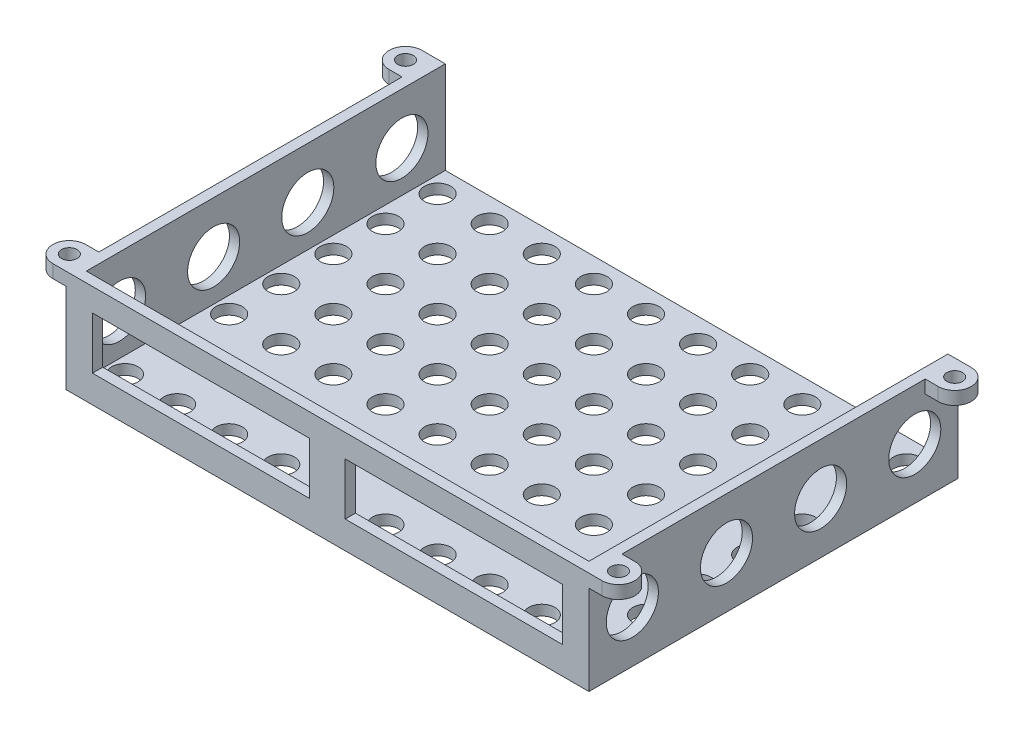
from build123d import *

# Parameters (mm, degrees)
SKETCH1_W                  = 153
SKETCH1_H                  = 108
BOSS_EXTRUDE1_DEPTH        = 30
SHELL1_T                   = -3
SKETCH7_R                  = 2.286
BOSS_EXTRUDE7_DEPTH        = 3.81
SKETCH24_R                 = 3.845268573
CUT_EXTRUDE8_DEPTH         = 25.4
LPATTERN5_COUNT            = 10
LPATTERN5_PITCH            = 15.24
LPATTERN6_COPY_1_SKETCH_R  = 3.845268573
LPATTERN6_COPY_1_DEPTH     = 25.4
LPATTERN6_COPY_2_SKETCH_R  = 3.845268573
LPATTERN6_COPY_2_DEPTH     = 25.4
LPATTERN6_COPY_3_SKETCH_R  = 3.845268573
LPATTERN6_COPY_3_DEPTH     = 25.4
LPATTERN6_COPY_4_SKETCH_R  = 3.845268573
LPATTERN6_COPY_4_DEPTH     = 25.4
LPATTERN6_COPY_5_SKETCH_R  = 3.845268573
LPATTERN6_COPY_5_DEPTH     = 25.4
LPATTERN6_COPY_6_SKETCH_R  = 3.845268573
LPATTERN6_COPY_6_DEPTH     = 25.4
LPATTERN6_COPY_7_SKETCH_R  = 3.845268573
LPATTERN6_COPY_7_DEPTH     = 25.4
LPATTERN6_COPY_8_SKETCH_R  = 3.845268573
LPATTERN6_COPY_8_DEPTH     = 25.4
LPATTERN6_COPY_9_SKETCH_R  = 3.845268573
LPATTERN6_COPY_9_DEPTH     = 25.4
LPATTERN6_COPY_10_SKETCH_R = 3.845268573
LPATTERN6_COPY_10_DEPTH    = 25.4
LPATTERN6_COPY_11_SKETCH_R = 3.845268573
LPATTERN6_COPY_11_DEPTH    = 25.4
LPATTERN6_COPY_12_SKETCH_R = 3.845268573
LPATTERN6_COPY_12_DEPTH    = 25.4
LPATTERN6_COPY_13_SKETCH_R = 3.845268573
LPATTERN6_COPY_13_DEPTH    = 25.4
LPATTERN6_COPY_14_SKETCH_R = 3.845268573
LPATTERN6_COPY_14_DEPTH    = 25.4
LPATTERN6_COPY_15_SKETCH_R = 3.845268573
LPATTERN6_COPY_15_DEPTH    = 25.4
LPATTERN6_COPY_16_SKETCH_R = 3.845268573
LPATTERN6_COPY_16_DEPTH    = 25.4
LPATTERN6_COPY_17_SKETCH_R = 3.845268573
LPATTERN6_COPY_17_DEPTH    = 25.4
LPATTERN6_COPY_18_SKETCH_R = 3.845268573
LPATTERN6_COPY_18_DEPTH    = 25.4
LPATTERN6_COPY_19_SKETCH_R = 3.845268573
LPATTERN6_COPY_19_DEPTH    = 25.4
LPATTERN6_COPY_20_SKETCH_R = 3.845268573
LPATTERN6_COPY_20_DEPTH    = 25.4
LPATTERN6_COPY_21_SKETCH_R = 3.845268573
LPATTERN6_COPY_21_DEPTH    = 25.4
LPATTERN6_COPY_22_SKETCH_R = 3.845268573
LPATTERN6_COPY_22_DEPTH    = 25.4
LPATTERN6_COPY_23_SKETCH_R = 3.845268573
LPATTERN6_COPY_23_DEPTH    = 25.4
LPATTERN6_COPY_24_SKETCH_R = 3.845268573
LPATTERN6_COPY_24_DEPTH    = 25.4
LPATTERN6_COPY_25_SKETCH_R = 3.845268573
LPATTERN6_COPY_25_DEPTH    = 25.4
LPATTERN6_COPY_26_SKETCH_R = 3.845268573
LPATTERN6_COPY_26_DEPTH    = 25.4
LPATTERN6_COPY_27_SKETCH_R = 3.845268573
LPATTERN6_COPY_27_DEPTH    = 25.4
LPATTERN6_COPY_28_SKETCH_R = 3.845268573
LPATTERN6_COPY_28_DEPTH    = 25.4
LPATTERN6_COPY_29_SKETCH_R = 3.845268573
LPATTERN6_COPY_29_DEPTH    = 25.4
LPATTERN6_COPY_30_SKETCH_R = 3.845268573
LPATTERN6_COPY_30_DEPTH    = 25.4
LPATTERN6_COPY_31_SKETCH_R = 3.845268573
LPATTERN6_COPY_31_DEPTH    = 25.4
LPATTERN6_COPY_32_SKETCH_R = 3.845268573
LPATTERN6_COPY_32_DEPTH    = 25.4
LPATTERN6_COPY_33_SKETCH_R = 3.845268573
LPATTERN6_COPY_33_DEPTH    = 25.4
LPATTERN6_COPY_34_SKETCH_R = 3.845268573
LPATTERN6_COPY_34_DEPTH    = 25.4
LPATTERN6_COPY_35_SKETCH_R = 3.845268573
LPATTERN6_COPY_35_DEPTH    = 25.4
LPATTERN6_COPY_36_SKETCH_R = 3.845268573
LPATTERN6_COPY_36_DEPTH    = 25.4
LPATTERN6_COPY_37_SKETCH_R = 3.845268573
LPATTERN6_COPY_37_DEPTH    = 25.4
LPATTERN6_COPY_38_SKETCH_R = 3.845268573
LPATTERN6_COPY_38_DEPTH    = 25.4
LPATTERN6_COPY_39_SKETCH_R = 3.845268573
LPATTERN6_COPY_39_DEPTH    = 25.4
LPATTERN6_COPY_40_SKETCH_R = 3.845268573
LPATTERN6_COPY_40_DEPTH    = 25.4
LPATTERN6_COPY_41_SKETCH_R = 3.845268573
LPATTERN6_COPY_41_DEPTH    = 25.4
LPATTERN6_COPY_42_SKETCH_R = 3.845268573
LPATTERN6_COPY_42_DEPTH    = 25.4
LPATTERN6_COPY_43_SKETCH_R = 3.845268573
LPATTERN6_COPY_43_DEPTH    = 25.4
LPATTERN6_COPY_44_SKETCH_R = 3.845268573
LPATTERN6_COPY_44_DEPTH    = 25.4
LPATTERN6_COPY_45_SKETCH_R = 3.845268573
LPATTERN6_COPY_45_DEPTH    = 25.4
LPATTERN6_COPY_46_SKETCH_R = 3.845268573
LPATTERN6_COPY_46_DEPTH    = 25.4
LPATTERN6_COPY_47_SKETCH_R = 3.845268573
LPATTERN6_COPY_47_DEPTH    = 25.4
LPATTERN6_COPY_48_SKETCH_R = 3.845268573
LPATTERN6_COPY_48_DEPTH    = 25.4
LPATTERN6_COPY_49_SKETCH_R = 3.845268573
LPATTERN6_COPY_49_DEPTH    = 25.4
LPATTERN6_COPY_50_SKETCH_R = 3.845268573
LPATTERN6_COPY_50_DEPTH    = 25.4
LPATTERN6_COPY_51_SKETCH_R = 3.845268573
LPATTERN6_COPY_51_DEPTH    = 25.4
LPATTERN6_COPY_52_SKETCH_R = 3.845268573
LPATTERN6_COPY_52_DEPTH    = 25.4
LPATTERN6_COPY_53_SKETCH_R = 3.845268573
LPATTERN6_COPY_53_DEPTH    = 25.4
LPATTERN6_COPY_54_SKETCH_R = 3.845268573
LPATTERN6_COPY_54_DEPTH    = 25.4
LPATTERN6_COPY_55_SKETCH_R = 3.845268573
LPATTERN6_COPY_55_DEPTH    = 25.4
LPATTERN6_COPY_56_SKETCH_R = 3.845268573
LPATTERN6_COPY_56_DEPTH    = 25.4
LPATTERN6_COPY_57_SKETCH_R = 3.845268573
LPATTERN6_COPY_57_DEPTH    = 25.4
LPATTERN6_COPY_58_SKETCH_R = 3.845268573
LPATTERN6_COPY_58_DEPTH    = 25.4
LPATTERN6_COPY_59_SKETCH_R = 3.845268573
LPATTERN6_COPY_59_DEPTH    = 25.4
LPATTERN6_COPY_60_SKETCH_R = 3.845268573
LPATTERN6_COPY_60_DEPTH    = 25.4
LPATTERN6_COPY_61_SKETCH_R = 3.845268573
LPATTERN6_COPY_61_DEPTH    = 25.4
LPATTERN6_COPY_62_SKETCH_R = 3.845268573
LPATTERN6_COPY_62_DEPTH    = 25.4
LPATTERN6_COPY_63_SKETCH_R = 3.845268573
LPATTERN6_COPY_63_DEPTH    = 25.4
LPATTERN6_COPY_64_SKETCH_R = 3.845268573
LPATTERN6_COPY_64_DEPTH    = 25.4
LPATTERN6_COPY_65_SKETCH_R = 3.845268573
LPATTERN6_COPY_65_DEPTH    = 25.4
LPATTERN6_COPY_66_SKETCH_R = 3.845268573
LPATTERN6_COPY_66_DEPTH    = 25.4
LPATTERN6_COPY_67_SKETCH_R = 3.845268573
LPATTERN6_COPY_67_DEPTH    = 25.4
LPATTERN6_COPY_68_SKETCH_R = 3.845268573
LPATTERN6_COPY_68_DEPTH    = 25.4
LPATTERN6_COPY_69_SKETCH_R = 3.845268573
LPATTERN6_COPY_69_DEPTH    = 25.4
LPATTERN6_COPY_70_SKETCH_R = 3.845268573
LPATTERN6_COPY_70_DEPTH    = 25.4
LPATTERN6_COPY_71_SKETCH_R = 3.845268573
LPATTERN6_COPY_71_DEPTH    = 25.4
LPATTERN6_COPY_72_SKETCH_R = 3.845268573
LPATTERN6_COPY_72_DEPTH    = 25.4
LPATTERN6_COPY_73_SKETCH_R = 3.845268573
LPATTERN6_COPY_73_DEPTH    = 25.4
LPATTERN6_COPY_74_SKETCH_R = 3.845268573
LPATTERN6_COPY_74_DEPTH    = 25.4
LPATTERN6_COPY_75_SKETCH_R = 3.845268573
LPATTERN6_COPY_75_DEPTH    = 25.4
LPATTERN6_COPY_76_SKETCH_R = 3.845268573
LPATTERN6_COPY_76_DEPTH    = 25.4
LPATTERN6_COPY_77_SKETCH_R = 3.845268573
LPATTERN6_COPY_77_DEPTH    = 25.4
LPATTERN6_COPY_78_SKETCH_R = 3.845268573
LPATTERN6_COPY_78_DEPTH    = 25.4
LPATTERN6_COPY_79_SKETCH_R = 3.845268573
LPATTERN6_COPY_79_DEPTH    = 25.4
LPATTERN6_COPY_80_SKETCH_R = 3.845268573
LPATTERN6_COPY_80_DEPTH    = 25.4
LPATTERN6_COPY_81_SKETCH_R = 3.845268573
LPATTERN6_COPY_81_DEPTH    = 25.4
LPATTERN6_COPY_82_SKETCH_R = 3.845268573
LPATTERN6_COPY_82_DEPTH    = 25.4
LPATTERN6_COPY_83_SKETCH_R = 3.845268573
LPATTERN6_COPY_83_DEPTH    = 25.4
LPATTERN6_COPY_84_SKETCH_R = 3.845268573
LPATTERN6_COPY_84_DEPTH    = 25.4
LPATTERN6_COPY_85_SKETCH_R = 3.845268573
LPATTERN6_COPY_85_DEPTH    = 25.4
LPATTERN6_COPY_86_SKETCH_R = 3.845268573
LPATTERN6_COPY_86_DEPTH    = 25.4
LPATTERN6_COPY_87_SKETCH_R = 3.845268573
LPATTERN6_COPY_87_DEPTH    = 25.4
LPATTERN6_COPY_88_SKETCH_R = 3.845268573
LPATTERN6_COPY_88_DEPTH    = 25.4
LPATTERN6_COPY_89_SKETCH_R = 3.845268573
LPATTERN6_COPY_89_DEPTH    = 25.4
LPATTERN6_COPY_90_SKETCH_R = 3.845268573
LPATTERN6_COPY_90_DEPTH    = 25.4
SKETCH27_W                 = 147
SKETCH27_H                 = 27
CUT_EXTRUDE10_DEPTH        = 5.08
SKETCH30_R                 = 7.62
CUT_EXTRUDE14_DEPTH        = 7.62
MIRROR2_COPY_1_SKETCH_R    = 2.286
MIRROR2_COPY_1_DEPTH       = 3.81
MIRROR2_COPY_2_SKETCH_R    = 2.286
MIRROR2_COPY_2_DEPTH       = 3.81
SKETCH33_W                 = 63.5
SKETCH33_H                 = 15.24
CUT_EXTRUDE16_DEPTH        = 5.08


with BuildPart() as part:
    # Sketch1 → Boss-Extrude1 (new body)
    with BuildSketch(Plane(origin=(0, 0, 0), x_dir=(1, 0, 0), z_dir=(0, 1, 0))):
        with Locations((-76.5, -54)):
            Rectangle(SKETCH1_W, SKETCH1_H)
    extrude(amount=BOSS_EXTRUDE1_DEPTH)

    # Shell1
    shell1_openings = [part.faces().sort_by_distance(p)[0] for p in [
        (-76.5, 30, 54),
    ]]
    offset(amount=SHELL1_T, openings=shell1_openings, kind=Kind.INTERSECTION)

    # Sketch7 → Boss-Extrude7 (add)
    with BuildSketch(Plane(origin=(0, 30, 0), x_dir=(1, 0, 0), z_dir=(0, 1, 0))):
        with BuildLine():
            Line((-156.81, 0), (-153, 0))
            Line((-153, 0), (-153, -9.652))
            Line((-153, -9.652), (-156.81, -9.652))
            ThreePointArc((-156.81, -9.652), (-161.636, -4.826), (-156.81, 0))
        make_face()
        with Locations((-156.81, -4.826)):
            Circle(SKETCH7_R, mode=Mode.SUBTRACT)
    boss_extrude7 = extrude(amount=-BOSS_EXTRUDE7_DEPTH)

    # Sketch24 → Cut-Extrude8 (cut)
    with BuildSketch(Plane.XZ):
        with Locations((-8.055715174, 7.051094555)):
            Circle(SKETCH24_R)
    cut_extrude8 = extrude(amount=-CUT_EXTRUDE8_DEPTH, mode=Mode.SUBTRACT)

    # LPattern5: Cut-Extrude8 ×10
    with Locations(*[(-i * LPATTERN5_PITCH, 0, 0) for i in range(1, LPATTERN5_COUNT)]):
        add(cut_extrude8, mode=Mode.SUBTRACT)

    # LPattern6 copy 1 sketch → LPattern6 copy 1 (cut)
    with BuildSketch(Plane(origin=(-15.24, 0, 15.24), x_dir=(1, 0, 0), z_dir=(0, -1, 0))):
        with Locations((-8.055715174, 7.051094555)):
            Circle(LPATTERN6_COPY_1_SKETCH_R)
    extrude(amount=-LPATTERN6_COPY_1_DEPTH, mode=Mode.SUBTRACT)

    # LPattern6 copy 2 sketch → LPattern6 copy 2 (cut)
    with BuildSketch(Plane(origin=(-15.24, 0, 30.48), x_dir=(1, 0, 0), z_dir=(0, -1, 0))):
        with Locations((-8.055715174, 7.051094555)):
            Circle(LPATTERN6_COPY_2_SKETCH_R)
    extrude(amount=-LPATTERN6_COPY_2_DEPTH, mode=Mode.SUBTRACT)

    # LPattern6 copy 3 sketch → LPattern6 copy 3 (cut)
    with BuildSketch(Plane(origin=(-15.24, 0, 45.72), x_dir=(1, 0, 0), z_dir=(0, -1, 0))):
        with Locations((-8.055715174, 7.051094555)):
            Circle(LPATTERN6_COPY_3_SKETCH_R)
    extrude(amount=-LPATTERN6_COPY_3_DEPTH, mode=Mode.SUBTRACT)

    # LPattern6 copy 4 sketch → LPattern6 copy 4 (cut)
    with BuildSketch(Plane(origin=(-15.24, 0, 60.96), x_dir=(1, 0, 0), z_dir=(0, -1, 0))):
        with Locations((-8.055715174, 7.051094555)):
            Circle(LPATTERN6_COPY_4_SKETCH_R)
    extrude(amount=-LPATTERN6_COPY_4_DEPTH, mode=Mode.SUBTRACT)

    # LPattern6 copy 5 sketch → LPattern6 copy 5 (cut)
    with BuildSketch(Plane(origin=(-15.24, 0, 76.2), x_dir=(1, 0, 0), z_dir=(0, -1, 0))):
        with Locations((-8.055715174, 7.051094555)):
            Circle(LPATTERN6_COPY_5_SKETCH_R)
    extrude(amount=-LPATTERN6_COPY_5_DEPTH, mode=Mode.SUBTRACT)

    # LPattern6 copy 6 sketch → LPattern6 copy 6 (cut)
    with BuildSketch(Plane(origin=(-15.24, 0, 91.44), x_dir=(1, 0, 0), z_dir=(0, -1, 0))):
        with Locations((-8.055715174, 7.051094555)):
            Circle(LPATTERN6_COPY_6_SKETCH_R)
    extrude(amount=-LPATTERN6_COPY_6_DEPTH, mode=Mode.SUBTRACT)

    # LPattern6 copy 7 sketch → LPattern6 copy 7 (cut)
    with BuildSketch(Plane(origin=(-15.24, 0, 106.68), x_dir=(1, 0, 0), z_dir=(0, -1, 0))):
        with Locations((-8.055715174, 7.051094555)):
            Circle(LPATTERN6_COPY_7_SKETCH_R)
    extrude(amount=-LPATTERN6_COPY_7_DEPTH, mode=Mode.SUBTRACT)

    # LPattern6 copy 8 sketch → LPattern6 copy 8 (cut)
    with BuildSketch(Plane(origin=(-15.24, 0, 121.92), x_dir=(1, 0, 0), z_dir=(0, -1, 0))):
        with Locations((-8.055715174, 7.051094555)):
            Circle(LPATTERN6_COPY_8_SKETCH_R)
    extrude(amount=-LPATTERN6_COPY_8_DEPTH, mode=Mode.SUBTRACT)

    # LPattern6 copy 9 sketch → LPattern6 copy 9 (cut)
    with BuildSketch(Plane(origin=(-15.24, 0, 137.16), x_dir=(1, 0, 0), z_dir=(0, -1, 0))):
        with Locations((-8.055715174, 7.051094555)):
            Circle(LPATTERN6_COPY_9_SKETCH_R)
    extrude(amount=-LPATTERN6_COPY_9_DEPTH, mode=Mode.SUBTRACT)

    # LPattern6 copy 10 sketch → LPattern6 copy 10 (cut)
    with BuildSketch(Plane(origin=(-30.48, 0, 15.24), x_dir=(1, 0, 0), z_dir=(0, -1, 0))):
        with Locations((-8.055715174, 7.051094555)):
            Circle(LPATTERN6_COPY_10_SKETCH_R)
    extrude(amount=-LPATTERN6_COPY_10_DEPTH, mode=Mode.SUBTRACT)

    # LPattern6 copy 11 sketch → LPattern6 copy 11 (cut)
    with BuildSketch(Plane(origin=(-30.48, 0, 30.48), x_dir=(1, 0, 0), z_dir=(0, -1, 0))):
        with Locations((-8.055715174, 7.051094555)):
            Circle(LPATTERN6_COPY_11_SKETCH_R)
    extrude(amount=-LPATTERN6_COPY_11_DEPTH, mode=Mode.SUBTRACT)

    # LPattern6 copy 12 sketch → LPattern6 copy 12 (cut)
    with BuildSketch(Plane(origin=(-30.48, 0, 45.72), x_dir=(1, 0, 0), z_dir=(0, -1, 0))):
        with Locations((-8.055715174, 7.051094555)):
            Circle(LPATTERN6_COPY_12_SKETCH_R)
    extrude(amount=-LPATTERN6_COPY_12_DEPTH, mode=Mode.SUBTRACT)

    # LPattern6 copy 13 sketch → LPattern6 copy 13 (cut)
    with BuildSketch(Plane(origin=(-30.48, 0, 60.96), x_dir=(1, 0, 0), z_dir=(0, -1, 0))):
        with Locations((-8.055715174, 7.051094555)):
            Circle(LPATTERN6_COPY_13_SKETCH_R)
    extrude(amount=-LPATTERN6_COPY_13_DEPTH, mode=Mode.SUBTRACT)

    # LPattern6 copy 14 sketch → LPattern6 copy 14 (cut)
    with BuildSketch(Plane(origin=(-30.48, 0, 76.2), x_dir=(1, 0, 0), z_dir=(0, -1, 0))):
        with Locations((-8.055715174, 7.051094555)):
            Circle(LPATTERN6_COPY_14_SKETCH_R)
    extrude(amount=-LPATTERN6_COPY_14_DEPTH, mode=Mode.SUBTRACT)

    # LPattern6 copy 15 sketch → LPattern6 copy 15 (cut)
    with BuildSketch(Plane(origin=(-30.48, 0, 91.44), x_dir=(1, 0, 0), z_dir=(0, -1, 0))):
        with Locations((-8.055715174, 7.051094555)):
            Circle(LPATTERN6_COPY_15_SKETCH_R)
    extrude(amount=-LPATTERN6_COPY_15_DEPTH, mode=Mode.SUBTRACT)

    # LPattern6 copy 16 sketch → LPattern6 copy 16 (cut)
    with BuildSketch(Plane(origin=(-30.48, 0, 106.68), x_dir=(1, 0, 0), z_dir=(0, -1, 0))):
        with Locations((-8.055715174, 7.051094555)):
            Circle(LPATTERN6_COPY_16_SKETCH_R)
    extrude(amount=-LPATTERN6_COPY_16_DEPTH, mode=Mode.SUBTRACT)

    # LPattern6 copy 17 sketch → LPattern6 copy 17 (cut)
    with BuildSketch(Plane(origin=(-30.48, 0, 121.92), x_dir=(1, 0, 0), z_dir=(0, -1, 0))):
        with Locations((-8.055715174, 7.051094555)):
            Circle(LPATTERN6_COPY_17_SKETCH_R)
    extrude(amount=-LPATTERN6_COPY_17_DEPTH, mode=Mode.SUBTRACT)

    # LPattern6 copy 18 sketch → LPattern6 copy 18 (cut)
    with BuildSketch(Plane(origin=(-30.48, 0, 137.16), x_dir=(1, 0, 0), z_dir=(0, -1, 0))):
        with Locations((-8.055715174, 7.051094555)):
            Circle(LPATTERN6_COPY_18_SKETCH_R)
    extrude(amount=-LPATTERN6_COPY_18_DEPTH, mode=Mode.SUBTRACT)

    # LPattern6 copy 19 sketch → LPattern6 copy 19 (cut)
    with BuildSketch(Plane(origin=(-45.72, 0, 15.24), x_dir=(1, 0, 0), z_dir=(0, -1, 0))):
        with Locations((-8.055715174, 7.051094555)):
            Circle(LPATTERN6_COPY_19_SKETCH_R)
    extrude(amount=-LPATTERN6_COPY_19_DEPTH, mode=Mode.SUBTRACT)

    # LPattern6 copy 20 sketch → LPattern6 copy 20 (cut)
    with BuildSketch(Plane(origin=(-45.72, 0, 30.48), x_dir=(1, 0, 0), z_dir=(0, -1, 0))):
        with Locations((-8.055715174, 7.051094555)):
            Circle(LPATTERN6_COPY_20_SKETCH_R)
    extrude(amount=-LPATTERN6_COPY_20_DEPTH, mode=Mode.SUBTRACT)

    # LPattern6 copy 21 sketch → LPattern6 copy 21 (cut)
    with BuildSketch(Plane(origin=(-45.72, 0, 45.72), x_dir=(1, 0, 0), z_dir=(0, -1, 0))):
        with Locations((-8.055715174, 7.051094555)):
            Circle(LPATTERN6_COPY_21_SKETCH_R)
    extrude(amount=-LPATTERN6_COPY_21_DEPTH, mode=Mode.SUBTRACT)

    # LPattern6 copy 22 sketch → LPattern6 copy 22 (cut)
    with BuildSketch(Plane(origin=(-45.72, 0, 60.96), x_dir=(1, 0, 0), z_dir=(0, -1, 0))):
        with Locations((-8.055715174, 7.051094555)):
            Circle(LPATTERN6_COPY_22_SKETCH_R)
    extrude(amount=-LPATTERN6_COPY_22_DEPTH, mode=Mode.SUBTRACT)

    # LPattern6 copy 23 sketch → LPattern6 copy 23 (cut)
    with BuildSketch(Plane(origin=(-45.72, 0, 76.2), x_dir=(1, 0, 0), z_dir=(0, -1, 0))):
        with Locations((-8.055715174, 7.051094555)):
            Circle(LPATTERN6_COPY_23_SKETCH_R)
    extrude(amount=-LPATTERN6_COPY_23_DEPTH, mode=Mode.SUBTRACT)

    # LPattern6 copy 24 sketch → LPattern6 copy 24 (cut)
    with BuildSketch(Plane(origin=(-45.72, 0, 91.44), x_dir=(1, 0, 0), z_dir=(0, -1, 0))):
        with Locations((-8.055715174, 7.051094555)):
            Circle(LPATTERN6_COPY_24_SKETCH_R)
    extrude(amount=-LPATTERN6_COPY_24_DEPTH, mode=Mode.SUBTRACT)

    # LPattern6 copy 25 sketch → LPattern6 copy 25 (cut)
    with BuildSketch(Plane(origin=(-45.72, 0, 106.68), x_dir=(1, 0, 0), z_dir=(0, -1, 0))):
        with Locations((-8.055715174, 7.051094555)):
            Circle(LPATTERN6_COPY_25_SKETCH_R)
    extrude(amount=-LPATTERN6_COPY_25_DEPTH, mode=Mode.SUBTRACT)

    # LPattern6 copy 26 sketch → LPattern6 copy 26 (cut)
    with BuildSketch(Plane(origin=(-45.72, 0, 121.92), x_dir=(1, 0, 0), z_dir=(0, -1, 0))):
        with Locations((-8.055715174, 7.051094555)):
            Circle(LPATTERN6_COPY_26_SKETCH_R)
    extrude(amount=-LPATTERN6_COPY_26_DEPTH, mode=Mode.SUBTRACT)

    # LPattern6 copy 27 sketch → LPattern6 copy 27 (cut)
    with BuildSketch(Plane(origin=(-45.72, 0, 137.16), x_dir=(1, 0, 0), z_dir=(0, -1, 0))):
        with Locations((-8.055715174, 7.051094555)):
            Circle(LPATTERN6_COPY_27_SKETCH_R)
    extrude(amount=-LPATTERN6_COPY_27_DEPTH, mode=Mode.SUBTRACT)

    # LPattern6 copy 28 sketch → LPattern6 copy 28 (cut)
    with BuildSketch(Plane(origin=(-60.96, 0, 15.24), x_dir=(1, 0, 0), z_dir=(0, -1, 0))):
        with Locations((-8.055715174, 7.051094555)):
            Circle(LPATTERN6_COPY_28_SKETCH_R)
    extrude(amount=-LPATTERN6_COPY_28_DEPTH, mode=Mode.SUBTRACT)

    # LPattern6 copy 29 sketch → LPattern6 copy 29 (cut)
    with BuildSketch(Plane(origin=(-60.96, 0, 30.48), x_dir=(1, 0, 0), z_dir=(0, -1, 0))):
        with Locations((-8.055715174, 7.051094555)):
            Circle(LPATTERN6_COPY_29_SKETCH_R)
    extrude(amount=-LPATTERN6_COPY_29_DEPTH, mode=Mode.SUBTRACT)

    # LPattern6 copy 30 sketch → LPattern6 copy 30 (cut)
    with BuildSketch(Plane(origin=(-60.96, 0, 45.72), x_dir=(1, 0, 0), z_dir=(0, -1, 0))):
        with Locations((-8.055715174, 7.051094555)):
            Circle(LPATTERN6_COPY_30_SKETCH_R)
    extrude(amount=-LPATTERN6_COPY_30_DEPTH, mode=Mode.SUBTRACT)

    # LPattern6 copy 31 sketch → LPattern6 copy 31 (cut)
    with BuildSketch(Plane(origin=(-60.96, 0, 60.96), x_dir=(1, 0, 0), z_dir=(0, -1, 0))):
        with Locations((-8.055715174, 7.051094555)):
            Circle(LPATTERN6_COPY_31_SKETCH_R)
    extrude(amount=-LPATTERN6_COPY_31_DEPTH, mode=Mode.SUBTRACT)

    # LPattern6 copy 32 sketch → LPattern6 copy 32 (cut)
    with BuildSketch(Plane(origin=(-60.96, 0, 76.2), x_dir=(1, 0, 0), z_dir=(0, -1, 0))):
        with Locations((-8.055715174, 7.051094555)):
            Circle(LPATTERN6_COPY_32_SKETCH_R)
    extrude(amount=-LPATTERN6_COPY_32_DEPTH, mode=Mode.SUBTRACT)

    # LPattern6 copy 33 sketch → LPattern6 copy 33 (cut)
    with BuildSketch(Plane(origin=(-60.96, 0, 91.44), x_dir=(1, 0, 0), z_dir=(0, -1, 0))):
        with Locations((-8.055715174, 7.051094555)):
            Circle(LPATTERN6_COPY_33_SKETCH_R)
    extrude(amount=-LPATTERN6_COPY_33_DEPTH, mode=Mode.SUBTRACT)

    # LPattern6 copy 34 sketch → LPattern6 copy 34 (cut)
    with BuildSketch(Plane(origin=(-60.96, 0, 106.68), x_dir=(1, 0, 0), z_dir=(0, -1, 0))):
        with Locations((-8.055715174, 7.051094555)):
            Circle(LPATTERN6_COPY_34_SKETCH_R)
    extrude(amount=-LPATTERN6_COPY_34_DEPTH, mode=Mode.SUBTRACT)

    # LPattern6 copy 35 sketch → LPattern6 copy 35 (cut)
    with BuildSketch(Plane(origin=(-60.96, 0, 121.92), x_dir=(1, 0, 0), z_dir=(0, -1, 0))):
        with Locations((-8.055715174, 7.051094555)):
            Circle(LPATTERN6_COPY_35_SKETCH_R)
    extrude(amount=-LPATTERN6_COPY_35_DEPTH, mode=Mode.SUBTRACT)

    # LPattern6 copy 36 sketch → LPattern6 copy 36 (cut)
    with BuildSketch(Plane(origin=(-60.96, 0, 137.16), x_dir=(1, 0, 0), z_dir=(0, -1, 0))):
        with Locations((-8.055715174, 7.051094555)):
            Circle(LPATTERN6_COPY_36_SKETCH_R)
    extrude(amount=-LPATTERN6_COPY_36_DEPTH, mode=Mode.SUBTRACT)

    # LPattern6 copy 37 sketch → LPattern6 copy 37 (cut)
    with BuildSketch(Plane(origin=(-76.2, 0, 15.24), x_dir=(1, 0, 0), z_dir=(0, -1, 0))):
        with Locations((-8.055715174, 7.051094555)):
            Circle(LPATTERN6_COPY_37_SKETCH_R)
    extrude(amount=-LPATTERN6_COPY_37_DEPTH, mode=Mode.SUBTRACT)

    # LPattern6 copy 38 sketch → LPattern6 copy 38 (cut)
    with BuildSketch(Plane(origin=(-76.2, 0, 30.48), x_dir=(1, 0, 0), z_dir=(0, -1, 0))):
        with Locations((-8.055715174, 7.051094555)):
            Circle(LPATTERN6_COPY_38_SKETCH_R)
    extrude(amount=-LPATTERN6_COPY_38_DEPTH, mode=Mode.SUBTRACT)

    # LPattern6 copy 39 sketch → LPattern6 copy 39 (cut)
    with BuildSketch(Plane(origin=(-76.2, 0, 45.72), x_dir=(1, 0, 0), z_dir=(0, -1, 0))):
        with Locations((-8.055715174, 7.051094555)):
            Circle(LPATTERN6_COPY_39_SKETCH_R)
    extrude(amount=-LPATTERN6_COPY_39_DEPTH, mode=Mode.SUBTRACT)

    # LPattern6 copy 40 sketch → LPattern6 copy 40 (cut)
    with BuildSketch(Plane(origin=(-76.2, 0, 60.96), x_dir=(1, 0, 0), z_dir=(0, -1, 0))):
        with Locations((-8.055715174, 7.051094555)):
            Circle(LPATTERN6_COPY_40_SKETCH_R)
    extrude(amount=-LPATTERN6_COPY_40_DEPTH, mode=Mode.SUBTRACT)

    # LPattern6 copy 41 sketch → LPattern6 copy 41 (cut)
    with BuildSketch(Plane(origin=(-76.2, 0, 76.2), x_dir=(1, 0, 0), z_dir=(0, -1, 0))):
        with Locations((-8.055715174, 7.051094555)):
            Circle(LPATTERN6_COPY_41_SKETCH_R)
    extrude(amount=-LPATTERN6_COPY_41_DEPTH, mode=Mode.SUBTRACT)

    # LPattern6 copy 42 sketch → LPattern6 copy 42 (cut)
    with BuildSketch(Plane(origin=(-76.2, 0, 91.44), x_dir=(1, 0, 0), z_dir=(0, -1, 0))):
        with Locations((-8.055715174, 7.051094555)):
            Circle(LPATTERN6_COPY_42_SKETCH_R)
    extrude(amount=-LPATTERN6_COPY_42_DEPTH, mode=Mode.SUBTRACT)

    # LPattern6 copy 43 sketch → LPattern6 copy 43 (cut)
    with BuildSketch(Plane(origin=(-76.2, 0, 106.68), x_dir=(1, 0, 0), z_dir=(0, -1, 0))):
        with Locations((-8.055715174, 7.051094555)):
            Circle(LPATTERN6_COPY_43_SKETCH_R)
    extrude(amount=-LPATTERN6_COPY_43_DEPTH, mode=Mode.SUBTRACT)

    # LPattern6 copy 44 sketch → LPattern6 copy 44 (cut)
    with BuildSketch(Plane(origin=(-76.2, 0, 121.92), x_dir=(1, 0, 0), z_dir=(0, -1, 0))):
        with Locations((-8.055715174, 7.051094555)):
            Circle(LPATTERN6_COPY_44_SKETCH_R)
    extrude(amount=-LPATTERN6_COPY_44_DEPTH, mode=Mode.SUBTRACT)

    # LPattern6 copy 45 sketch → LPattern6 copy 45 (cut)
    with BuildSketch(Plane(origin=(-76.2, 0, 137.16), x_dir=(1, 0, 0), z_dir=(0, -1, 0))):
        with Locations((-8.055715174, 7.051094555)):
            Circle(LPATTERN6_COPY_45_SKETCH_R)
    extrude(amount=-LPATTERN6_COPY_45_DEPTH, mode=Mode.SUBTRACT)

    # LPattern6 copy 46 sketch → LPattern6 copy 46 (cut)
    with BuildSketch(Plane(origin=(-91.44, 0, 15.24), x_dir=(1, 0, 0), z_dir=(0, -1, 0))):
        with Locations((-8.055715174, 7.051094555)):
            Circle(LPATTERN6_COPY_46_SKETCH_R)
    extrude(amount=-LPATTERN6_COPY_46_DEPTH, mode=Mode.SUBTRACT)

    # LPattern6 copy 47 sketch → LPattern6 copy 47 (cut)
    with BuildSketch(Plane(origin=(-91.44, 0, 30.48), x_dir=(1, 0, 0), z_dir=(0, -1, 0))):
        with Locations((-8.055715174, 7.051094555)):
            Circle(LPATTERN6_COPY_47_SKETCH_R)
    extrude(amount=-LPATTERN6_COPY_47_DEPTH, mode=Mode.SUBTRACT)

    # LPattern6 copy 48 sketch → LPattern6 copy 48 (cut)
    with BuildSketch(Plane(origin=(-91.44, 0, 45.72), x_dir=(1, 0, 0), z_dir=(0, -1, 0))):
        with Locations((-8.055715174, 7.051094555)):
            Circle(LPATTERN6_COPY_48_SKETCH_R)
    extrude(amount=-LPATTERN6_COPY_48_DEPTH, mode=Mode.SUBTRACT)

    # LPattern6 copy 49 sketch → LPattern6 copy 49 (cut)
    with BuildSketch(Plane(origin=(-91.44, 0, 60.96), x_dir=(1, 0, 0), z_dir=(0, -1, 0))):
        with Locations((-8.055715174, 7.051094555)):
            Circle(LPATTERN6_COPY_49_SKETCH_R)
    extrude(amount=-LPATTERN6_COPY_49_DEPTH, mode=Mode.SUBTRACT)

    # LPattern6 copy 50 sketch → LPattern6 copy 50 (cut)
    with BuildSketch(Plane(origin=(-91.44, 0, 76.2), x_dir=(1, 0, 0), z_dir=(0, -1, 0))):
        with Locations((-8.055715174, 7.051094555)):
            Circle(LPATTERN6_COPY_50_SKETCH_R)
    extrude(amount=-LPATTERN6_COPY_50_DEPTH, mode=Mode.SUBTRACT)

    # LPattern6 copy 51 sketch → LPattern6 copy 51 (cut)
    with BuildSketch(Plane(origin=(-91.44, 0, 91.44), x_dir=(1, 0, 0), z_dir=(0, -1, 0))):
        with Locations((-8.055715174, 7.051094555)):
            Circle(LPATTERN6_COPY_51_SKETCH_R)
    extrude(amount=-LPATTERN6_COPY_51_DEPTH, mode=Mode.SUBTRACT)

    # LPattern6 copy 52 sketch → LPattern6 copy 52 (cut)
    with BuildSketch(Plane(origin=(-91.44, 0, 106.68), x_dir=(1, 0, 0), z_dir=(0, -1, 0))):
        with Locations((-8.055715174, 7.051094555)):
            Circle(LPATTERN6_COPY_52_SKETCH_R)
    extrude(amount=-LPATTERN6_COPY_52_DEPTH, mode=Mode.SUBTRACT)

    # LPattern6 copy 53 sketch → LPattern6 copy 53 (cut)
    with BuildSketch(Plane(origin=(-91.44, 0, 121.92), x_dir=(1, 0, 0), z_dir=(0, -1, 0))):
        with Locations((-8.055715174, 7.051094555)):
            Circle(LPATTERN6_COPY_53_SKETCH_R)
    extrude(amount=-LPATTERN6_COPY_53_DEPTH, mode=Mode.SUBTRACT)

    # LPattern6 copy 54 sketch → LPattern6 copy 54 (cut)
    with BuildSketch(Plane(origin=(-91.44, 0, 137.16), x_dir=(1, 0, 0), z_dir=(0, -1, 0))):
        with Locations((-8.055715174, 7.051094555)):
            Circle(LPATTERN6_COPY_54_SKETCH_R)
    extrude(amount=-LPATTERN6_COPY_54_DEPTH, mode=Mode.SUBTRACT)

    # LPattern6 copy 55 sketch → LPattern6 copy 55 (cut)
    with BuildSketch(Plane(origin=(-106.68, 0, 15.24), x_dir=(1, 0, 0), z_dir=(0, -1, 0))):
        with Locations((-8.055715174, 7.051094555)):
            Circle(LPATTERN6_COPY_55_SKETCH_R)
    extrude(amount=-LPATTERN6_COPY_55_DEPTH, mode=Mode.SUBTRACT)

    # LPattern6 copy 56 sketch → LPattern6 copy 56 (cut)
    with BuildSketch(Plane(origin=(-106.68, 0, 30.48), x_dir=(1, 0, 0), z_dir=(0, -1, 0))):
        with Locations((-8.055715174, 7.051094555)):
            Circle(LPATTERN6_COPY_56_SKETCH_R)
    extrude(amount=-LPATTERN6_COPY_56_DEPTH, mode=Mode.SUBTRACT)

    # LPattern6 copy 57 sketch → LPattern6 copy 57 (cut)
    with BuildSketch(Plane(origin=(-106.68, 0, 45.72), x_dir=(1, 0, 0), z_dir=(0, -1, 0))):
        with Locations((-8.055715174, 7.051094555)):
            Circle(LPATTERN6_COPY_57_SKETCH_R)
    extrude(amount=-LPATTERN6_COPY_57_DEPTH, mode=Mode.SUBTRACT)

    # LPattern6 copy 58 sketch → LPattern6 copy 58 (cut)
    with BuildSketch(Plane(origin=(-106.68, 0, 60.96), x_dir=(1, 0, 0), z_dir=(0, -1, 0))):
        with Locations((-8.055715174, 7.051094555)):
            Circle(LPATTERN6_COPY_58_SKETCH_R)
    extrude(amount=-LPATTERN6_COPY_58_DEPTH, mode=Mode.SUBTRACT)

    # LPattern6 copy 59 sketch → LPattern6 copy 59 (cut)
    with BuildSketch(Plane(origin=(-106.68, 0, 76.2), x_dir=(1, 0, 0), z_dir=(0, -1, 0))):
        with Locations((-8.055715174, 7.051094555)):
            Circle(LPATTERN6_COPY_59_SKETCH_R)
    extrude(amount=-LPATTERN6_COPY_59_DEPTH, mode=Mode.SUBTRACT)

    # LPattern6 copy 60 sketch → LPattern6 copy 60 (cut)
    with BuildSketch(Plane(origin=(-106.68, 0, 91.44), x_dir=(1, 0, 0), z_dir=(0, -1, 0))):
        with Locations((-8.055715174, 7.051094555)):
            Circle(LPATTERN6_COPY_60_SKETCH_R)
    extrude(amount=-LPATTERN6_COPY_60_DEPTH, mode=Mode.SUBTRACT)

    # LPattern6 copy 61 sketch → LPattern6 copy 61 (cut)
    with BuildSketch(Plane(origin=(-106.68, 0, 106.68), x_dir=(1, 0, 0), z_dir=(0, -1, 0))):
        with Locations((-8.055715174, 7.051094555)):
            Circle(LPATTERN6_COPY_61_SKETCH_R)
    extrude(amount=-LPATTERN6_COPY_61_DEPTH, mode=Mode.SUBTRACT)

    # LPattern6 copy 62 sketch → LPattern6 copy 62 (cut)
    with BuildSketch(Plane(origin=(-106.68, 0, 121.92), x_dir=(1, 0, 0), z_dir=(0, -1, 0))):
        with Locations((-8.055715174, 7.051094555)):
            Circle(LPATTERN6_COPY_62_SKETCH_R)
    extrude(amount=-LPATTERN6_COPY_62_DEPTH, mode=Mode.SUBTRACT)

    # LPattern6 copy 63 sketch → LPattern6 copy 63 (cut)
    with BuildSketch(Plane(origin=(-106.68, 0, 137.16), x_dir=(1, 0, 0), z_dir=(0, -1, 0))):
        with Locations((-8.055715174, 7.051094555)):
            Circle(LPATTERN6_COPY_63_SKETCH_R)
    extrude(amount=-LPATTERN6_COPY_63_DEPTH, mode=Mode.SUBTRACT)

    # LPattern6 copy 64 sketch → LPattern6 copy 64 (cut)
    with BuildSketch(Plane(origin=(-121.92, 0, 15.24), x_dir=(1, 0, 0), z_dir=(0, -1, 0))):
        with Locations((-8.055715174, 7.051094555)):
            Circle(LPATTERN6_COPY_64_SKETCH_R)
    extrude(amount=-LPATTERN6_COPY_64_DEPTH, mode=Mode.SUBTRACT)

    # LPattern6 copy 65 sketch → LPattern6 copy 65 (cut)
    with BuildSketch(Plane(origin=(-121.92, 0, 30.48), x_dir=(1, 0, 0), z_dir=(0, -1, 0))):
        with Locations((-8.055715174, 7.051094555)):
            Circle(LPATTERN6_COPY_65_SKETCH_R)
    extrude(amount=-LPATTERN6_COPY_65_DEPTH, mode=Mode.SUBTRACT)

    # LPattern6 copy 66 sketch → LPattern6 copy 66 (cut)
    with BuildSketch(Plane(origin=(-121.92, 0, 45.72), x_dir=(1, 0, 0), z_dir=(0, -1, 0))):
        with Locations((-8.055715174, 7.051094555)):
            Circle(LPATTERN6_COPY_66_SKETCH_R)
    extrude(amount=-LPATTERN6_COPY_66_DEPTH, mode=Mode.SUBTRACT)

    # LPattern6 copy 67 sketch → LPattern6 copy 67 (cut)
    with BuildSketch(Plane(origin=(-121.92, 0, 60.96), x_dir=(1, 0, 0), z_dir=(0, -1, 0))):
        with Locations((-8.055715174, 7.051094555)):
            Circle(LPATTERN6_COPY_67_SKETCH_R)
    extrude(amount=-LPATTERN6_COPY_67_DEPTH, mode=Mode.SUBTRACT)

    # LPattern6 copy 68 sketch → LPattern6 copy 68 (cut)
    with BuildSketch(Plane(origin=(-121.92, 0, 76.2), x_dir=(1, 0, 0), z_dir=(0, -1, 0))):
        with Locations((-8.055715174, 7.051094555)):
            Circle(LPATTERN6_COPY_68_SKETCH_R)
    extrude(amount=-LPATTERN6_COPY_68_DEPTH, mode=Mode.SUBTRACT)

    # LPattern6 copy 69 sketch → LPattern6 copy 69 (cut)
    with BuildSketch(Plane(origin=(-121.92, 0, 91.44), x_dir=(1, 0, 0), z_dir=(0, -1, 0))):
        with Locations((-8.055715174, 7.051094555)):
            Circle(LPATTERN6_COPY_69_SKETCH_R)
    extrude(amount=-LPATTERN6_COPY_69_DEPTH, mode=Mode.SUBTRACT)

    # LPattern6 copy 70 sketch → LPattern6 copy 70 (cut)
    with BuildSketch(Plane(origin=(-121.92, 0, 106.68), x_dir=(1, 0, 0), z_dir=(0, -1, 0))):
        with Locations((-8.055715174, 7.051094555)):
            Circle(LPATTERN6_COPY_70_SKETCH_R)
    extrude(amount=-LPATTERN6_COPY_70_DEPTH, mode=Mode.SUBTRACT)

    # LPattern6 copy 71 sketch → LPattern6 copy 71 (cut)
    with BuildSketch(Plane(origin=(-121.92, 0, 121.92), x_dir=(1, 0, 0), z_dir=(0, -1, 0))):
        with Locations((-8.055715174, 7.051094555)):
            Circle(LPATTERN6_COPY_71_SKETCH_R)
    extrude(amount=-LPATTERN6_COPY_71_DEPTH, mode=Mode.SUBTRACT)

    # LPattern6 copy 72 sketch → LPattern6 copy 72 (cut)
    with BuildSketch(Plane(origin=(-121.92, 0, 137.16), x_dir=(1, 0, 0), z_dir=(0, -1, 0))):
        with Locations((-8.055715174, 7.051094555)):
            Circle(LPATTERN6_COPY_72_SKETCH_R)
    extrude(amount=-LPATTERN6_COPY_72_DEPTH, mode=Mode.SUBTRACT)

    # LPattern6 copy 73 sketch → LPattern6 copy 73 (cut)
    with BuildSketch(Plane(origin=(-137.16, 0, 15.24), x_dir=(1, 0, 0), z_dir=(0, -1, 0))):
        with Locations((-8.055715174, 7.051094555)):
            Circle(LPATTERN6_COPY_73_SKETCH_R)
    extrude(amount=-LPATTERN6_COPY_73_DEPTH, mode=Mode.SUBTRACT)

    # LPattern6 copy 74 sketch → LPattern6 copy 74 (cut)
    with BuildSketch(Plane(origin=(-137.16, 0, 30.48), x_dir=(1, 0, 0), z_dir=(0, -1, 0))):
        with Locations((-8.055715174, 7.051094555)):
            Circle(LPATTERN6_COPY_74_SKETCH_R)
    extrude(amount=-LPATTERN6_COPY_74_DEPTH, mode=Mode.SUBTRACT)

    # LPattern6 copy 75 sketch → LPattern6 copy 75 (cut)
    with BuildSketch(Plane(origin=(-137.16, 0, 45.72), x_dir=(1, 0, 0), z_dir=(0, -1, 0))):
        with Locations((-8.055715174, 7.051094555)):
            Circle(LPATTERN6_COPY_75_SKETCH_R)
    extrude(amount=-LPATTERN6_COPY_75_DEPTH, mode=Mode.SUBTRACT)

    # LPattern6 copy 76 sketch → LPattern6 copy 76 (cut)
    with BuildSketch(Plane(origin=(-137.16, 0, 60.96), x_dir=(1, 0, 0), z_dir=(0, -1, 0))):
        with Locations((-8.055715174, 7.051094555)):
            Circle(LPATTERN6_COPY_76_SKETCH_R)
    extrude(amount=-LPATTERN6_COPY_76_DEPTH, mode=Mode.SUBTRACT)

    # LPattern6 copy 77 sketch → LPattern6 copy 77 (cut)
    with BuildSketch(Plane(origin=(-137.16, 0, 76.2), x_dir=(1, 0, 0), z_dir=(0, -1, 0))):
        with Locations((-8.055715174, 7.051094555)):
            Circle(LPATTERN6_COPY_77_SKETCH_R)
    extrude(amount=-LPATTERN6_COPY_77_DEPTH, mode=Mode.SUBTRACT)

    # LPattern6 copy 78 sketch → LPattern6 copy 78 (cut)
    with BuildSketch(Plane(origin=(-137.16, 0, 91.44), x_dir=(1, 0, 0), z_dir=(0, -1, 0))):
        with Locations((-8.055715174, 7.051094555)):
            Circle(LPATTERN6_COPY_78_SKETCH_R)
    extrude(amount=-LPATTERN6_COPY_78_DEPTH, mode=Mode.SUBTRACT)

    # LPattern6 copy 79 sketch → LPattern6 copy 79 (cut)
    with BuildSketch(Plane(origin=(-137.16, 0, 106.68), x_dir=(1, 0, 0), z_dir=(0, -1, 0))):
        with Locations((-8.055715174, 7.051094555)):
            Circle(LPATTERN6_COPY_79_SKETCH_R)
    extrude(amount=-LPATTERN6_COPY_79_DEPTH, mode=Mode.SUBTRACT)

    # LPattern6 copy 80 sketch → LPattern6 copy 80 (cut)
    with BuildSketch(Plane(origin=(-137.16, 0, 121.92), x_dir=(1, 0, 0), z_dir=(0, -1, 0))):
        with Locations((-8.055715174, 7.051094555)):
            Circle(LPATTERN6_COPY_80_SKETCH_R)
    extrude(amount=-LPATTERN6_COPY_80_DEPTH, mode=Mode.SUBTRACT)

    # LPattern6 copy 81 sketch → LPattern6 copy 81 (cut)
    with BuildSketch(Plane(origin=(-137.16, 0, 137.16), x_dir=(1, 0, 0), z_dir=(0, -1, 0))):
        with Locations((-8.055715174, 7.051094555)):
            Circle(LPATTERN6_COPY_81_SKETCH_R)
    extrude(amount=-LPATTERN6_COPY_81_DEPTH, mode=Mode.SUBTRACT)

    # LPattern6 copy 82 sketch → LPattern6 copy 82 (cut)
    with BuildSketch(Plane(origin=(0, 0, 15.24), x_dir=(1, 0, 0), z_dir=(0, -1, 0))):
        with Locations((-8.055715174, 7.051094555)):
            Circle(LPATTERN6_COPY_82_SKETCH_R)
    extrude(amount=-LPATTERN6_COPY_82_DEPTH, mode=Mode.SUBTRACT)

    # LPattern6 copy 83 sketch → LPattern6 copy 83 (cut)
    with BuildSketch(Plane(origin=(0, 0, 30.48), x_dir=(1, 0, 0), z_dir=(0, -1, 0))):
        with Locations((-8.055715174, 7.051094555)):
            Circle(LPATTERN6_COPY_83_SKETCH_R)
    extrude(amount=-LPATTERN6_COPY_83_DEPTH, mode=Mode.SUBTRACT)

    # LPattern6 copy 84 sketch → LPattern6 copy 84 (cut)
    with BuildSketch(Plane(origin=(0, 0, 45.72), x_dir=(1, 0, 0), z_dir=(0, -1, 0))):
        with Locations((-8.055715174, 7.051094555)):
            Circle(LPATTERN6_COPY_84_SKETCH_R)
    extrude(amount=-LPATTERN6_COPY_84_DEPTH, mode=Mode.SUBTRACT)

    # LPattern6 copy 85 sketch → LPattern6 copy 85 (cut)
    with BuildSketch(Plane(origin=(0, 0, 60.96), x_dir=(1, 0, 0), z_dir=(0, -1, 0))):
        with Locations((-8.055715174, 7.051094555)):
            Circle(LPATTERN6_COPY_85_SKETCH_R)
    extrude(amount=-LPATTERN6_COPY_85_DEPTH, mode=Mode.SUBTRACT)

    # LPattern6 copy 86 sketch → LPattern6 copy 86 (cut)
    with BuildSketch(Plane(origin=(0, 0, 76.2), x_dir=(1, 0, 0), z_dir=(0, -1, 0))):
        with Locations((-8.055715174, 7.051094555)):
            Circle(LPATTERN6_COPY_86_SKETCH_R)
    extrude(amount=-LPATTERN6_COPY_86_DEPTH, mode=Mode.SUBTRACT)

    # LPattern6 copy 87 sketch → LPattern6 copy 87 (cut)
    with BuildSketch(Plane(origin=(0, 0, 91.44), x_dir=(1, 0, 0), z_dir=(0, -1, 0))):
        with Locations((-8.055715174, 7.051094555)):
            Circle(LPATTERN6_COPY_87_SKETCH_R)
    extrude(amount=-LPATTERN6_COPY_87_DEPTH, mode=Mode.SUBTRACT)

    # LPattern6 copy 88 sketch → LPattern6 copy 88 (cut)
    with BuildSketch(Plane(origin=(0, 0, 106.68), x_dir=(1, 0, 0), z_dir=(0, -1, 0))):
        with Locations((-8.055715174, 7.051094555)):
            Circle(LPATTERN6_COPY_88_SKETCH_R)
    extrude(amount=-LPATTERN6_COPY_88_DEPTH, mode=Mode.SUBTRACT)

    # LPattern6 copy 89 sketch → LPattern6 copy 89 (cut)
    with BuildSketch(Plane(origin=(0, 0, 121.92), x_dir=(1, 0, 0), z_dir=(0, -1, 0))):
        with Locations((-8.055715174, 7.051094555)):
            Circle(LPATTERN6_COPY_89_SKETCH_R)
    extrude(amount=-LPATTERN6_COPY_89_DEPTH, mode=Mode.SUBTRACT)

    # LPattern6 copy 90 sketch → LPattern6 copy 90 (cut)
    with BuildSketch(Plane(origin=(0, 0, 137.16), x_dir=(1, 0, 0), z_dir=(0, -1, 0))):
        with Locations((-8.055715174, 7.051094555)):
            Circle(LPATTERN6_COPY_90_SKETCH_R)
    extrude(amount=-LPATTERN6_COPY_90_DEPTH, mode=Mode.SUBTRACT)

    # Sketch27 → Cut-Extrude10 (cut)
    with BuildSketch(Plane.XY.offset(3)):
        with Locations((-76.5, 16.5)):
            Rectangle(SKETCH27_W, SKETCH27_H)
    extrude(amount=-CUT_EXTRUDE10_DEPTH, mode=Mode.SUBTRACT)

    # Sketch30 → Cut-Extrude14 (cut)
    with BuildSketch(Plane(origin=(0, 0, 0), x_dir=(0, 0, -1), z_dir=(1, 0, 0))):
        with Locations((-12.7, 15)):
            Circle(SKETCH30_R)
        with Locations((-40.233333333, 15)):
            Circle(SKETCH30_R)
        with Locations((-67.766666667, 15)):
            Circle(SKETCH30_R)
        with Locations((-95.3, 15)):
            Circle(SKETCH30_R)
    cut_extrude14 = extrude(amount=-CUT_EXTRUDE14_DEPTH, mode=Mode.SUBTRACT)

    # Mirror1: Boss-Extrude7 across plane
    add(boss_extrude7.mirror(Plane(origin=(0, 0, 54), x_dir=(1, 0, 0), z_dir=(0, 0, -1))))

    # Mirror2 copy 1 sketch → Mirror2 copy 1 (add)
    with BuildSketch(Plane(origin=(-153, 30, 108), x_dir=(-1, 0, 0), z_dir=(0, 1, 0))):
        with BuildLine():
            Line((-156.81, 0), (-153, 0))
            Line((-153, 0), (-153, -9.652))
            Line((-153, -9.652), (-156.81, -9.652))
            ThreePointArc((-156.81, -9.652), (-161.636, -4.826), (-156.81, 0))
        make_face()
        with Locations((-156.81, -4.826)):
            Circle(MIRROR2_COPY_1_SKETCH_R, mode=Mode.SUBTRACT)
    extrude(amount=-MIRROR2_COPY_1_DEPTH)

    # Mirror2 copy 2 sketch → Mirror2 copy 2 (add)
    with BuildSketch(Plane(origin=(-153, 30, 0), x_dir=(-1, 0, 0), z_dir=(0, 1, 0))):
        with BuildLine():
            Line((-156.81, 0), (-153, 0))
            Line((-153, 0), (-153, 9.652))
            Line((-153, 9.652), (-156.81, 9.652))
            ThreePointArc((-156.81, 9.652), (-161.636, 4.826), (-156.81, 0))
        make_face()
        with Locations((-156.81, 4.826)):
            Circle(MIRROR2_COPY_2_SKETCH_R, mode=Mode.SUBTRACT)
    extrude(amount=-MIRROR2_COPY_2_DEPTH)

    # Mirror4: Cut-Extrude14 across plane
    add(cut_extrude14.mirror(Plane.ZY.offset(76.5)), mode=Mode.SUBTRACT)

    # Sketch33 → Cut-Extrude16 (cut)
    with BuildSketch(Plane.XY.offset(108)):
        with Locations((-113.457908856, 15.666577994)):
            Rectangle(SKETCH33_W, SKETCH33_H)
    cut_extrude16 = extrude(amount=-CUT_EXTRUDE16_DEPTH, mode=Mode.SUBTRACT)

    # Mirror6: Cut-Extrude16 across plane
    add(cut_extrude16.mirror(Plane.ZY.offset(76.5)), mode=Mode.SUBTRACT)


solid = part.part
